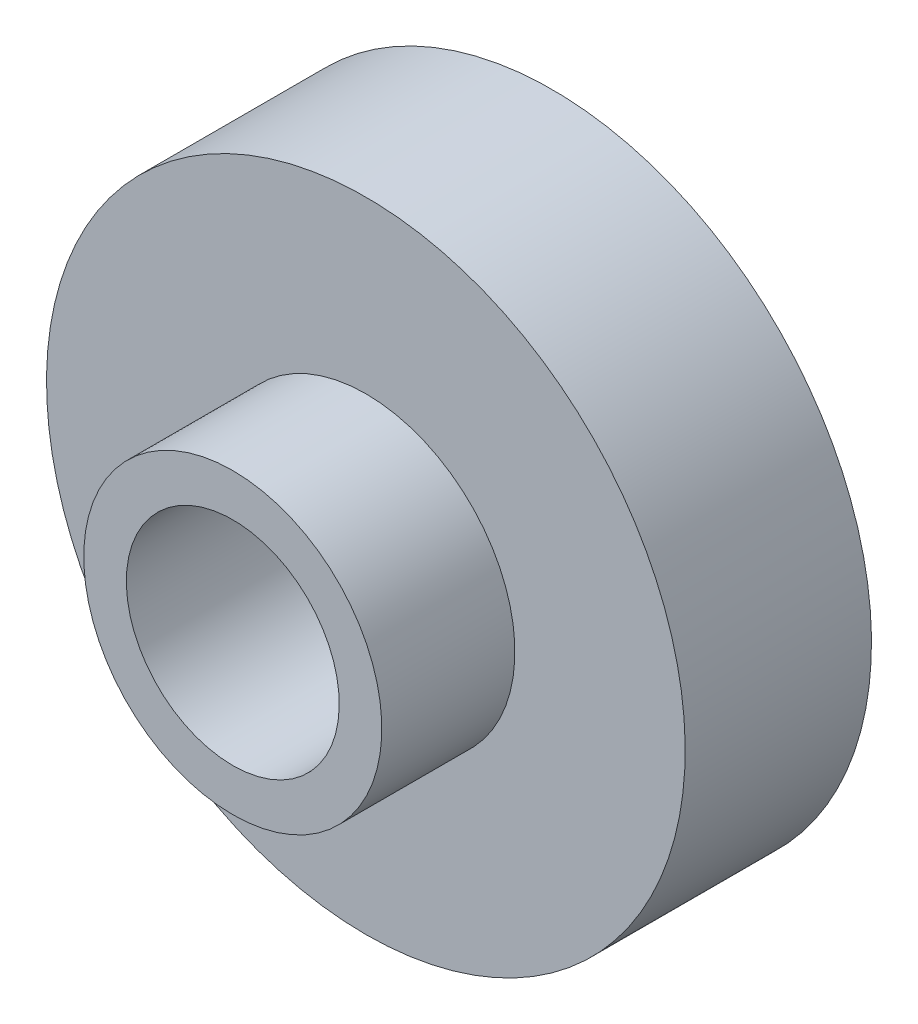
from build123d import *


with BuildPart() as part:
    # Sketch1 → Revolve1 (revolve)
    with BuildSketch(Plane(origin=(0, 0, 0), x_dir=(0, 0, -1), z_dir=(1, 0, 0))):
        Polygon((-152.4, 71.12), (-152.4, 50.8), (-66.04, 50.8), (-66.04, 63.5), (-40.64, 63.5), (-40.64, 101.6), (-58.42, 101.6), (-58.42, 114.3), (0, 114.3), (0, 152.4), (-88.9, 152.4), (-88.9, 71.12), align=None)
    revolve(axis=Axis((0, 0, 152.4), (0, 0, -1)))


solid = part.part
